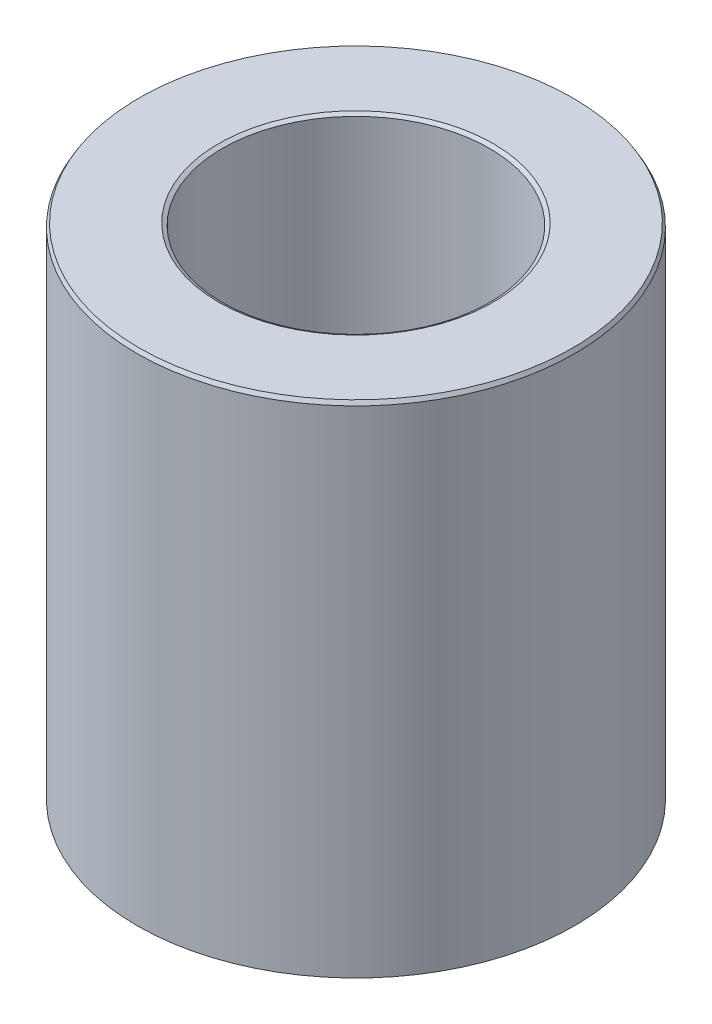
from build123d import *
from OCP.BRepFilletAPI import BRepFilletAPI_MakeChamfer

# Parameters (mm, degrees)
SKETCH1_R           = 42.5
BOSS_EXTRUDE1_DEPTH = 97.366084448
SKETCH2_R           = 25.938011412
CUT_EXTRUDE1_DEPTH  = 115.423137524
CHAMFER1_SIZE       = 0.730963979
CHAMFER1_SIZE2      = 0.42202225


with BuildPart() as part:
    # Sketch1 → Boss-Extrude1 (new body)
    with BuildSketch(Plane(origin=(0, 0, 0), x_dir=(1, 0, 0), z_dir=(0, 1, 0))):
        Circle(SKETCH1_R)
    extrude(amount=BOSS_EXTRUDE1_DEPTH)

    # Sketch2 → Cut-Extrude1 (cut, through all)
    with BuildSketch(Plane(origin=(0, 0, 0), x_dir=(1, 0, 0), z_dir=(0, 1, 0))):
        Circle(SKETCH2_R)
    extrude(amount=CUT_EXTRUDE1_DEPTH, mode=Mode.SUBTRACT)

    # Chamfer1: one chamfer whose edges measure the first distance from different faces: ONE call of the kernel's chamfer builder (chamfer() names one face for all edges)
    chamfer1_edges_1 = [part.edges().sort_by_distance(p)[0] for p in [
        (-25.938011412, 97.366084448, 0),
    ]]
    chamfer1_side_1 = [part.faces().sort_by_distance(p)[0] for p in [
        (-41.297918472, 97.366084448, 0),
    ]]
    chamfer1_edges_2 = [part.edges().sort_by_distance(p)[0] for p in [
        (-25.938011412, 0, 0),
    ]]
    chamfer1_side_2 = [part.faces().sort_by_distance(p)[0] for p in [
        (-25.938011412, 48.683042224, 0),
    ]]
    chamfer1_edges_3 = [part.edges().sort_by_distance(p)[0] for p in [
        (-42.5, 0, 0),
    ]]
    chamfer1_side_3 = [part.faces().sort_by_distance(p)[0] for p in [
        (-41.297918472, 0, 0),
    ]]
    chamfer1_edges_4 = [part.edges().sort_by_distance(p)[0] for p in [
        (-42.5, 97.366084448, 0),
    ]]
    chamfer1_side_4 = [part.faces().sort_by_distance(p)[0] for p in [
        (-42.5, 48.683042224, 0),
    ]]
    chamfer1 = BRepFilletAPI_MakeChamfer(part.part.solid().wrapped)
    for e in chamfer1_edges_1:
        chamfer1.Add(CHAMFER1_SIZE, CHAMFER1_SIZE2, e.wrapped, chamfer1_side_1[0].wrapped)  # the first distance lies on this face
    for e in chamfer1_edges_2:
        chamfer1.Add(CHAMFER1_SIZE, CHAMFER1_SIZE2, e.wrapped, chamfer1_side_2[0].wrapped)  # the first distance lies on this face
    for e in chamfer1_edges_3:
        chamfer1.Add(CHAMFER1_SIZE, CHAMFER1_SIZE2, e.wrapped, chamfer1_side_3[0].wrapped)  # the first distance lies on this face
    for e in chamfer1_edges_4:
        chamfer1.Add(CHAMFER1_SIZE, CHAMFER1_SIZE2, e.wrapped, chamfer1_side_4[0].wrapped)  # the first distance lies on this face
    add(Compound.cast(chamfer1.Shape()), mode=Mode.REPLACE)


solid = part.part
